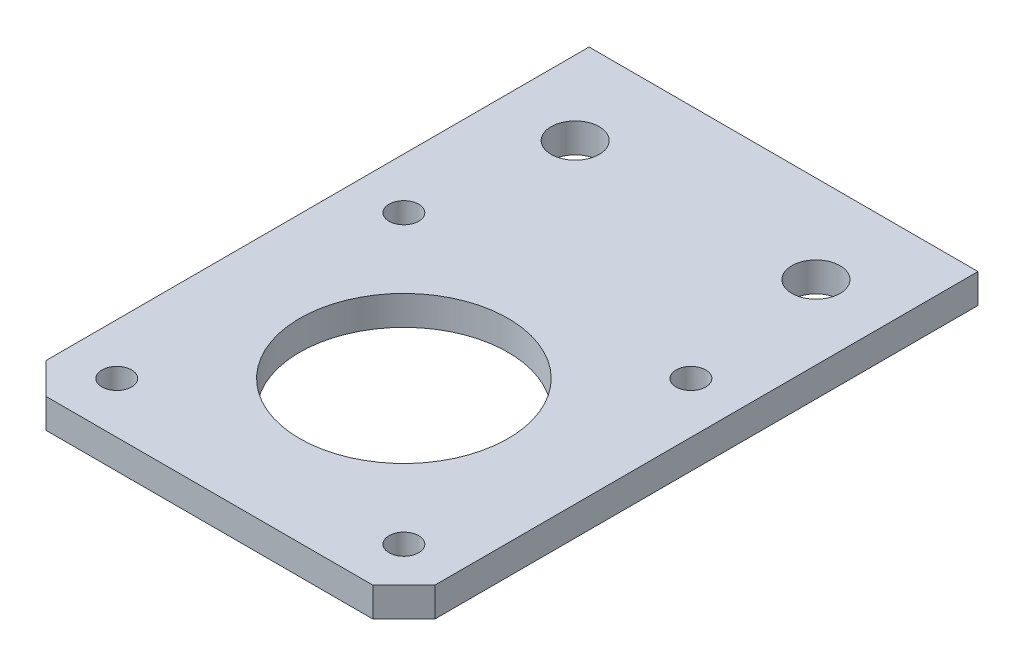
from build123d import *

# Parameters (mm, degrees)
SKETCH1_R           = 1.6
SKETCH1_R_2         = 11.25
SKETCH1_R_3         = 2.6
BOSS_EXTRUDE1_DEPTH = 3.175


with BuildPart() as part:
    # Sketch1 → Boss-Extrude1 (new body)
    with BuildSketch(Plane(origin=(0, 0, 0), x_dir=(1, 0, 0), z_dir=(0, 1, 0))):
        Polygon((-21, -17.645), (-17.645, -21), (17.645, -21), (21, -17.645), (21, 41), (-21, 41), align=None)
        with Locations((-15.5, -15.5)):
            Circle(SKETCH1_R, mode=Mode.SUBTRACT)
        with Locations((15.5, -15.5)):
            Circle(SKETCH1_R, mode=Mode.SUBTRACT)
        Circle(SKETCH1_R_2, mode=Mode.SUBTRACT)
        with Locations((-15.5, 15.5)):
            Circle(SKETCH1_R, mode=Mode.SUBTRACT)
        with Locations((15.5, 15.5)):
            Circle(SKETCH1_R, mode=Mode.SUBTRACT)
        with Locations((13, 31.5)):
            Circle(SKETCH1_R_3, mode=Mode.SUBTRACT)
        with Locations((-13, 31.5)):
            Circle(SKETCH1_R_3, mode=Mode.SUBTRACT)
    extrude(amount=BOSS_EXTRUDE1_DEPTH)


solid = part.part
